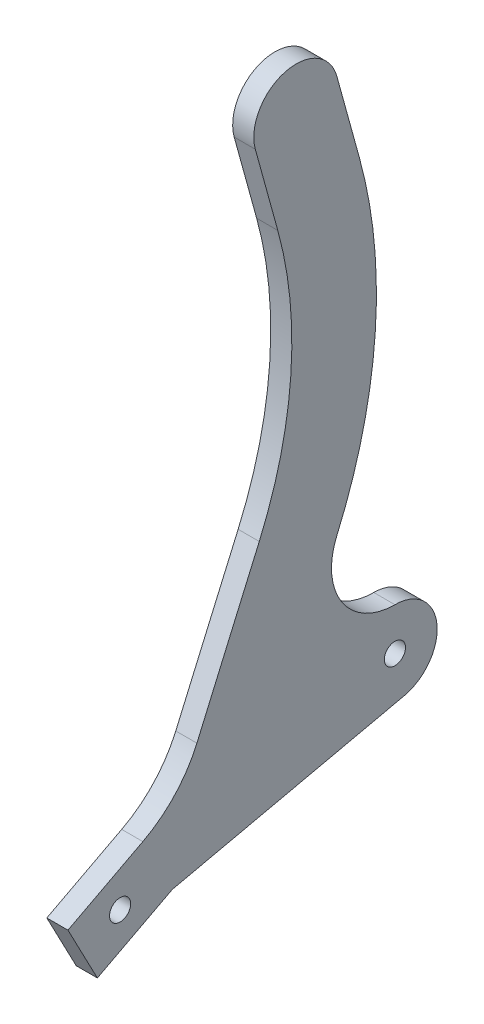
from build123d import *

# Parameters (mm, degrees)
SKETCH1_R           = 3.175
BOSS_EXTRUDE1_DEPTH = 6.35


with BuildPart() as part:
    # Sketch1 → Boss-Extrude1 (new body)
    with BuildSketch(Plane(origin=(0, 0, 0), x_dir=(0, 0, -1), z_dir=(1, 0, 0))):
        with BuildLine():
            Line((-75.721888101, -11.068478347), (-98.220132119, -22.85783864))
            Line((-98.220132119, -22.85783864), (-89.378111899, -39.731521653))
            Line((-89.378111899, -39.731521653), (-66.879867881, -27.94216136))
            Line((-66.879867881, -27.94216136), (2.7669164, -12.394925318))
            ThreePointArc((2.7669164, -12.394925318), (12.623500932, 1.391842028), (0, 12.7))
            ThreePointArc((0, 12.7), (-15.936201096, 21.312567622), (-17.462784388, 39.362730222))
            ThreePointArc((-17.462784388, 39.362730222), (-5.921340573, 86.302722272), (-10.695095154, 134.404479477))
            Line((-10.695095154, 134.404479477), (-17.44376381, 158.89152649))
            ThreePointArc((-17.44376381, 158.89152649), (-33.061621644, 167.760715668), (-41.930810822, 152.142857834))
            Line((-41.930810822, 152.142857834), (-38.556476494, 139.899334328))
            Line((-38.556476494, 139.899334328), (-35.182142166, 127.655810822))
            ThreePointArc((-35.182142166, 127.655810822), (-31.257188906, 88.106825725), (-40.746496905, 49.513037184))
            ThreePointArc((-40.746496905, 49.513037184), (-50.125086976, 27.968851155), (-59.481167953, 6.414880474))
            ThreePointArc((-59.481167953, 6.414880474), (-66.102955999, -3.718859191), (-75.721888101, -11.068478347))
        make_face()
        Circle(SKETCH1_R, mode=Mode.SUBTRACT)
        with Locations((-82.55, -25.4)):
            Circle(SKETCH1_R, mode=Mode.SUBTRACT)
    extrude(amount=BOSS_EXTRUDE1_DEPTH)


solid = part.part
